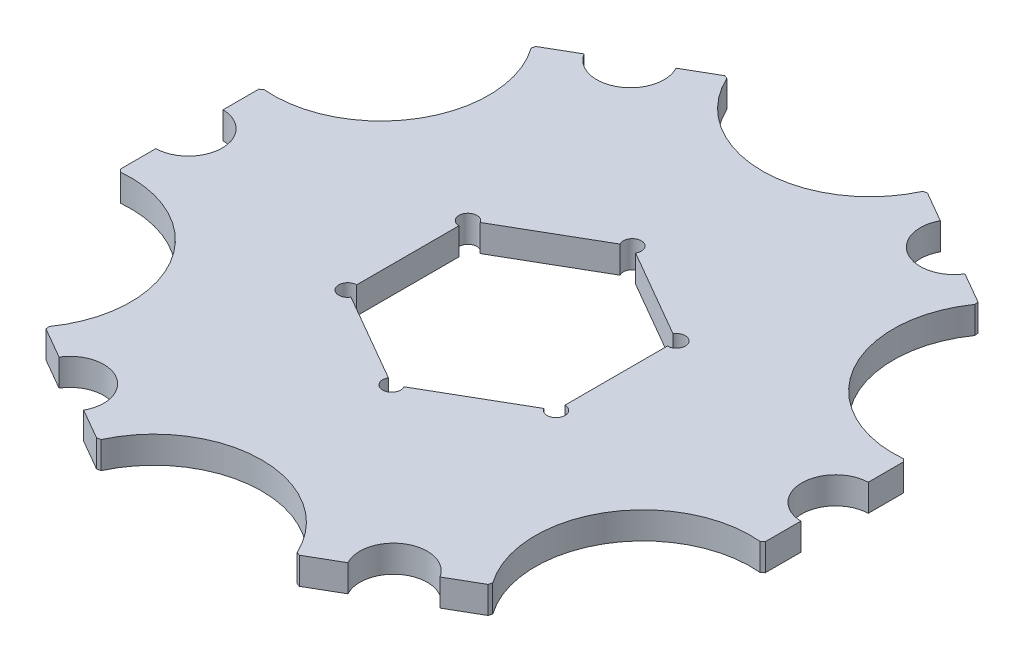
from build123d import *

# Parameters (mm, degrees)
BOSS_EXTRUDE1_DEPTH = 4.7625
CHAMFER1_SIZE       = 0.458146619
CHAMFER1_SIZE_2     = 0.508


with BuildPart() as part:
    # Sketch1 → Boss-Extrude1 (new body)
    with BuildSketch(Plane(origin=(0, 0, 0), x_dir=(1, 0, 0), z_dir=(0, 1, 0))):
        with BuildLine():
            ThreePointArc((-39.484622628, 42.989372509), (-38.273971566, 22.097487787), (-56.9722, 12.7))
            Line((-56.9722, 12.7), (-56.9722, 5.950469261))
            ThreePointArc((-56.9722, 5.950469261), (-51.196875, 0), (-56.9722, -5.950469261))
            Line((-56.9722, -5.950469261), (-56.9722, -12.7))
            ThreePointArc((-56.9722, -12.7), (-38.273971566, -22.097487787), (-39.484622628, -42.989372509))
            Line((-39.484622628, -42.989372509), (-33.639357544, -46.364137879))
            ThreePointArc((-33.639357544, -46.364137879), (-25.5984375, -44.337794344), (-23.332842456, -52.31460714))
            Line((-23.332842456, -52.31460714), (-17.487577372, -55.689372509))
            ThreePointArc((-17.487577372, -55.689372509), (0, -44.194975573), (17.487577372, -55.689372509))
            Line((17.487577372, -55.689372509), (23.332842456, -52.31460714))
            ThreePointArc((23.332842456, -52.31460714), (25.5984375, -44.337794344), (33.639357544, -46.364137879))
            Line((33.639357544, -46.364137879), (39.484622628, -42.989372509))
            ThreePointArc((39.484622628, -42.989372509), (38.273971566, -22.097487787), (56.9722, -12.7))
            Line((56.9722, -12.7), (56.9722, -5.950469261))
            ThreePointArc((56.9722, -5.950469261), (51.196875, 0), (56.9722, 5.950469261))
            Line((56.9722, 5.950469261), (56.9722, 12.7))
            ThreePointArc((56.9722, 12.7), (38.273971566, 22.097487787), (39.484622628, 42.989372509))
            Line((39.484622628, 42.989372509), (33.639357544, 46.364137879))
            ThreePointArc((33.639357544, 46.364137879), (25.5984375, 44.337794344), (23.332842456, 52.31460714))
            Line((23.332842456, 52.31460714), (17.487577372, 55.689372509))
            ThreePointArc((17.487577372, 55.689372509), (0, 44.194975573), (-17.487577372, 55.689372509))
            Line((-17.487577372, 55.689372509), (-23.332842456, 52.31460714))
            ThreePointArc((-23.332842456, 52.31460714), (-25.5984375, 44.337794344), (-33.639357544, 46.364137879))
            Line((-33.639357544, 46.364137879), (-39.484622628, 42.989372509))
        make_face()
        with BuildLine():
            Line((1.374815329, 20.455395717), (17.027484671, 11.418322859))
            ThreePointArc((17.027484671, 11.418322859), (18.813175234, 12.157980108), (19.9898, 10.624572859))
            ThreePointArc((19.9898, 10.624572859), (19.524832015, 9.502040844), (18.4023, 9.037072859))
            Line((18.4023, 9.037072859), (18.4023, -9.037072859))
            ThreePointArc((18.4023, -9.037072859), (19.524832015, -9.502040844), (19.9898, -10.624572859))
            ThreePointArc((19.9898, -10.624572859), (18.813175234, -12.157980108), (17.027484671, -11.418322859))
            Line((17.027484671, -11.418322859), (1.374815329, -20.455395717))
            ThreePointArc((1.374815329, -20.455395717), (1.533407249, -20.838270483), (1.5875, -21.249145717))
            ThreePointArc((1.5875, -21.249145717), (-0.410875234, -22.782552967), (-1.374815329, -20.455395717))
            Line((-1.374815329, -20.455395717), (-17.027484671, -11.418322859))
            ThreePointArc((-17.027484671, -11.418322859), (-19.777115329, -11.418322859), (-18.4023, -9.037072859))
            Line((-18.4023, -9.037072859), (-18.4023, 9.037072859))
            ThreePointArc((-18.4023, 9.037072859), (-19.777115329, 11.418322859), (-17.027484671, 11.418322859))
            Line((-17.027484671, 11.418322859), (-1.374815329, 20.455395717))
            ThreePointArc((-1.374815329, 20.455395717), (-0.410875234, 22.782552967), (1.5875, 21.249145717))
            ThreePointArc((1.5875, 21.249145717), (1.533407249, 20.838270483), (1.374815329, 20.455395717))
        make_face(mode=Mode.SUBTRACT)
    extrude(amount=BOSS_EXTRUDE1_DEPTH)

    # Chamfer1
    # the kernel refuses this chamfer: 0.508, 0.458146619 mm, written as the material it takes off along each edge
    with BuildSketch(Plane(origin=(-39.484622628, -1.324398774, 42.989372509), x_dir=(0.8660254037844506, 0, 0.49999999999997935), z_dir=(0, 1, 0)), Plane(origin=(-56.9722, -1.324398774, -12.7), x_dir=(0, 0, 1), z_dir=(0, 1, 0)), Plane(origin=(-17.487577372, -1.324398774, -55.689372509), x_dir=(-0.8660254037844313, 0, 0.5000000000000127), z_dir=(0, 1, 0)), Plane(origin=(39.484622628, -1.324398774, -42.989372509), x_dir=(-0.86602540378444, 0, -0.4999999999999977), z_dir=(0, 1, 0)), Plane(origin=(56.9722, -1.324398774, 12.7), x_dir=(0, 0, -1), z_dir=(0, 1, 0)), Plane(origin=(17.487577372, -1.324398774, 55.689372509), x_dir=(0.8660254037844486, 0, -0.4999999999999827), z_dir=(0, 1, 0))) as chamfer1_piece_1:
        with BuildLine():
            Line((CHAMFER1_SIZE, 0), (0.052567717, 0.512318712))
            ThreePointArc((0.052567717, 0.512318712), (0.028757334, 0.263227837), (0, 0))
            Line((0, 0), (CHAMFER1_SIZE, 0))
        make_face()
    extrude(amount=7.411297548, mode=Mode.SUBTRACT)
    with BuildSketch(Plane(origin=(-56.9722, -1.306414958, 12.7), x_dir=(0.9946357789180702, 0, -0.10343919613011188), z_dir=(0, 1, 0)), Plane(origin=(-39.484622628, -1.306414958, -42.989372509), x_dir=(0.5868988610547448, 0, 0.8096602539909213), z_dir=(0, 1, 0)), Plane(origin=(56.9722, -1.306414958, -12.7), x_dir=(-0.9946357789180716, 0, 0.1034391961300989), z_dir=(0, 1, 0)), Plane(origin=(39.484622628, -1.306414958, 42.989372509), x_dir=(-0.5868988610547374, 0, -0.8096602539909268), z_dir=(0, 1, 0)), Plane(origin=(-17.487577372, -1.306414958, 55.689372509), x_dir=(0.40773691786333366, 0, -0.91309945012102), z_dir=(0, 1, 0))) as chamfer1_piece_2:
        with BuildLine():
            Line((0.462627791, 0), (CHAMFER1_SIZE_2 * 0.10343919613, CHAMFER1_SIZE_2 * 0.994635778918))
            Line((CHAMFER1_SIZE_2 * 0.10343919613, CHAMFER1_SIZE_2 * 0.994635778918), (0, 0))
            ThreePointArc((0, 0), (0.237719559, 0.001403335), (0.462627791, 0))
        make_face()
    extrude(amount=7.375329916, mode=Mode.SUBTRACT)
    with BuildSketch(Plane(origin=(17.487577372, -1.306414958, -55.689372509), x_dir=(0.8660254037844403, 0, 0.49999999999999717), z_dir=(0, 1, 0))) as chamfer1_piece_3:
        with BuildLine():
            Line((CHAMFER1_SIZE_2, 0), (0.047853847, -0.460146153))
            ThreePointArc((0.047853847, -0.460146153), (0.025985327, -0.236299219), (0, 0))
            Line((0, 0), (CHAMFER1_SIZE_2, 0))
        make_face()
    extrude(amount=7.375329916, mode=Mode.SUBTRACT)


solid = part.part
